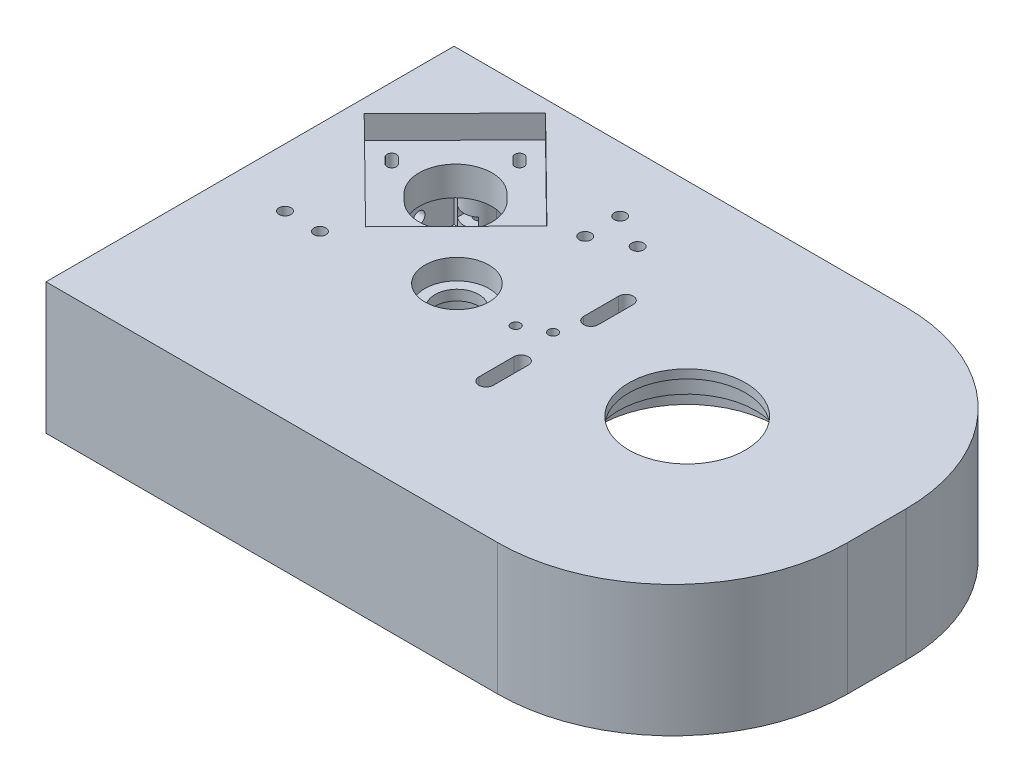
from build123d import *

# Parameters (mm, degrees)
SKETCH1_W               = 215
SKETCH1_H               = 140
BOSS_EXTRUDE1_DEPTH     = 10
FILLET1_R               = 60
SKETCH2_R               = 20
SKETCH2_R_2             = 7.5
CUT_EXTRUDE1_DEPTH      = 129.671092325
CUT_EXTRUDE2_DEPTH      = 129.671092325
CUT_EXTRUDE3_DEPTH      = 129.671092325
SKETCH5_R               = 11
CUT_EXTRUDE4_DEPTH      = 7
SKETCH6_R               = 14
SKETCH6_R_2             = 11
BOSS_EXTRUDE2_DEPTH     = 8.5
SKETCH7_R               = 23.5
CUT_EXTRUDE5_DEPTH      = 7
SKETCH8_R               = 38.5
SKETCH8_R_2             = 30.5
BOSS_EXTRUDE3_DEPTH     = 8
BOSS_EXTRUDE4_DEPTH     = 35
BOSS_EXTRUDE5_DEPTH     = 8
CUT_EXTRUDE6_DEPTH      = 8
SKETCH12_R              = 11
SKETCH12_R_2            = 7.5
BOSS_EXTRUDE6_DEPTH     = 0.5
BOSS_EXTRUDE7_REACH     = 137.946
SKETCH14_R              = 2.05
CUT_EXTRUDE7_DEPTH      = 3.6
BOSS_EXTRUDE8_REACH     = 137.946
SKETCH16_R              = 2.05
CUT_EXTRUDE8_START      = -3.6
CUT_EXTRUDE8_OUTLINE_R  = 2.05
CUT_EXTRUDE8_DEPTH      = 3.6
LPATTERN1_COUNT         = 3
LPATTERN1_PITCH         = 55
MIRROR2_COPY_1_REACH    = 137.946
MIRROR2_COPY_1_SKETCH_R = 2.05
MIRROR2_COPY_2_REACH    = 137.946
MIRROR2_COPY_2_SKETCH_R = 2.05
MIRROR2_START           = -3.6
MIRROR2_COPY_3_SKETCH_R = 2.05
MIRROR2_COPY_3_DEPTH    = 3.6
MIRROR2_COPY_4_SKETCH_R = 2.05
MIRROR2_COPY_4_DEPTH    = 3.6
BOSS_EXTRUDE9_REACH     = 137.946
SKETCH18_R              = 2.05
CUT_EXTRUDE9_DEPTH      = 3.6
BOSS_EXTRUDE10_DEPTH    = 8
CUT_EXTRUDE10_DEPTH     = 133.97086147
SKETCH22_R              = 1.6
CUT_EXTRUDE11_DEPTH     = 133.97086147
SKETCH23_R              = 2.05
CUT_EXTRUDE12_DEPTH     = 133.97086147
CUT_EXTRUDE13_REACH     = 230.801
SKETCH24_R              = 2.05


# Read off the part's stored shape, not the designer's step: Cut-Extrude8
with BuildPart() as part:
    # Sketch1 → Boss-Extrude1 (new body)
    with BuildSketch(Plane(origin=(0, 0, 0), x_dir=(1, 0, 0), z_dir=(0, 1, 0))):
        Rectangle(SKETCH1_W, SKETCH1_H)
    extrude(amount=BOSS_EXTRUDE1_DEPTH)

    # Fillet1
    fillet1_edges = [part.edges().sort_by_distance(p)[0] for p in [
        (107.5, 5, 70),
        (107.5, 5, -70),
    ]]
    fillet(fillet1_edges, radius=FILLET1_R)

    # Sketch2 → Cut-Extrude1 (cut, through all)
    with BuildSketch(Plane(origin=(0, 10, 0), x_dir=(1, 0, 0), z_dir=(0, 1, 0))):
        with Locations(Location((42.5, 0, 0), (0, 0, 270))):
            Circle(SKETCH2_R)
        with Locations(Location((-36.5, 0, 0), (0, 0, 270))):
            Circle(SKETCH2_R_2)
    extrude(amount=-CUT_EXTRUDE1_DEPTH, mode=Mode.SUBTRACT)

    # Sketch3 → Cut-Extrude2 (cut, through all)
    with BuildSketch(Plane(origin=(0, 10, 0), x_dir=(1, 0, 0), z_dir=(0, 1, 0))):
        with BuildLine():
            Line((-62.6171596, 43.302932631), (-60.480848158, 41.196710083))
            ThreePointArc((-60.480848158, 41.196710083), (-60.355477768, 23.519485123), (-78.032702727, 23.394114734))
            Line((-78.032702727, 23.394114734), (-80.169014169, 25.500337282))
            ThreePointArc((-80.169014169, 25.500337282), (-80.294384559, 43.177562241), (-62.6171596, 43.302932631))
        make_face()
    extrude(amount=-CUT_EXTRUDE2_DEPTH, mode=Mode.SUBTRACT)

    # Sketch4 → Cut-Extrude3 (cut, through all)
    with BuildSketch(Plane(origin=(0, 10, 0), x_dir=(1, 0, 0), z_dir=(0, 1, 0))):
        with BuildLine():
            Line((-48.467836076, 31.164041558), (-50.589156419, 33.285361902))
            ThreePointArc((-50.589156419, 33.285361902), (-50.589156419, 35.548103602), (-48.326414719, 35.548103602))
            Line((-48.326414719, 35.548103602), (-46.205094376, 33.426783258))
            ThreePointArc((-46.205094376, 33.426783258), (-46.205094376, 31.164041558), (-48.467836076, 31.164041558))
        make_face()
        with BuildLine():
            Line((-70.388146292, 53.084351775), (-72.509466636, 55.205672119))
            ThreePointArc((-72.509466636, 55.205672119), (-72.509466636, 57.468413818), (-70.246724936, 57.468413818))
            Line((-70.246724936, 57.468413818), (-68.125404593, 55.347093475))
            ThreePointArc((-68.125404593, 55.347093475), (-68.125404593, 53.084351775), (-70.388146292, 53.084351775))
        make_face()
        with BuildLine():
            Line((-70.388146292, 9.243731341), (-72.509466636, 11.365051685))
            ThreePointArc((-72.509466636, 11.365051685), (-72.509466636, 13.627793385), (-70.246724936, 13.627793385))
            Line((-70.246724936, 13.627793385), (-68.125404593, 11.506473041))
            ThreePointArc((-68.125404593, 11.506473041), (-68.125404593, 9.243731341), (-70.388146292, 9.243731341))
        make_face()
        with BuildLine():
            Line((-92.308456509, 31.164041558), (-94.429776853, 33.285361902))
            ThreePointArc((-94.429776853, 33.285361902), (-94.429776853, 35.548103602), (-92.167035153, 35.548103602))
            Line((-92.167035153, 35.548103602), (-90.045714809, 33.426783258))
            ThreePointArc((-90.045714809, 33.426783258), (-90.045714809, 31.164041558), (-92.308456509, 31.164041558))
        make_face()
    extrude(amount=-CUT_EXTRUDE3_DEPTH, mode=Mode.SUBTRACT)

    # Sketch5 → Cut-Extrude4 (cut)
    with BuildSketch(Plane(origin=(0, 10, 0), x_dir=(1, 0, 0), z_dir=(0, 1, 0))):
        with Locations(Location((-36.5, 0, 0), (0, 0, 270))):
            Circle(SKETCH5_R)
    extrude(amount=-CUT_EXTRUDE4_DEPTH, mode=Mode.SUBTRACT)

    # Sketch6 → Boss-Extrude2 (add)
    with BuildSketch(Plane.XZ):
        with Locations(Location((-36.5, 0, 0), (0, 0, 270))):
            Circle(SKETCH6_R)
        with Locations(Location((-36.5, 0, 0), (0, 0, 90))):
            Circle(SKETCH6_R_2, mode=Mode.SUBTRACT)
    extrude(amount=BOSS_EXTRUDE2_DEPTH)

    # Sketch7 → Cut-Extrude5 (cut)
    with BuildSketch(Plane.XZ):
        with Locations(Location((42.5, 0, 0), (0, 0, 270))):
            Circle(SKETCH7_R)
    extrude(amount=-CUT_EXTRUDE5_DEPTH, mode=Mode.SUBTRACT)

    # Sketch8 → Boss-Extrude3 (add)
    with BuildSketch(Plane.XZ):
        with Locations(Location((42.5, 0, 0), (0, 0, 270))):
            Circle(SKETCH8_R)
        with Locations(Location((42.5, 0, 0), (0, 0, 270))):
            Circle(SKETCH8_R_2, mode=Mode.SUBTRACT)
    extrude(amount=BOSS_EXTRUDE3_DEPTH)

    # Sketch9 → Boss-Extrude4 (add)
    with BuildSketch(Plane.XZ):
        with BuildLine():
            Line((-107.5, -70), (47.5, -70))
            ThreePointArc((47.5, -70), (89.926406871, -52.426406871), (107.5, -10))
            Line((107.5, -10), (107.5, 10))
            ThreePointArc((107.5, 10), (89.926406871, 52.426406871), (47.5, 70))
            Line((47.5, 70), (-107.5, 70))
            Line((-107.5, 70), (-107.5, -70))
        make_face()
        with BuildLine():
            Line((47.5, 62), (-99.5, 62))
            Line((-99.5, 62), (-99.5, -62))
            Line((-99.5, -62), (47.5, -62))
            ThreePointArc((47.5, -62), (84.269552622, -46.769552622), (99.5, -10))
            Line((99.5, -10), (99.5, 10))
            ThreePointArc((99.5, 10), (84.269552622, 46.769552622), (47.5, 62))
        make_face(mode=Mode.SUBTRACT)
    extrude(amount=BOSS_EXTRUDE4_DEPTH)

    # Sketch10 → Boss-Extrude5 (add)
    with BuildSketch(Plane.XZ):
        with BuildLine():
            Line((-36.5, -14), (-36.5, -62))
            Line((-36.5, -62), (-99.5, -62))
            Line((-99.5, -62), (-99.5, 0))
            Line((-99.5, 0), (-50.5, 0))
            ThreePointArc((-50.5, 0), (-46.399494937, -9.899494937), (-36.5, -14))
        make_face()
        with BuildLine():
            Line((-80.169014169, -25.500337282), (-78.032702727, -23.394114734))
            ThreePointArc((-78.032702727, -23.394114734), (-60.355477768, -23.519485123), (-60.480848158, -41.196710083))
            Line((-60.480848158, -41.196710083), (-62.6171596, -43.302932631))
            ThreePointArc((-62.6171596, -43.302932631), (-80.294384559, -43.177562241), (-80.169014169, -25.500337282))
        make_face(mode=Mode.SUBTRACT)
        with BuildLine():
            Line((-94.429776853, -33.285361902), (-92.308456509, -31.164041558))
            ThreePointArc((-92.308456509, -31.164041558), (-90.045714809, -31.164041558), (-90.045714809, -33.426783258))
            Line((-90.045714809, -33.426783258), (-92.167035153, -35.548103602))
            ThreePointArc((-92.167035153, -35.548103602), (-94.429776853, -35.548103602), (-94.429776853, -33.285361902))
        make_face(mode=Mode.SUBTRACT)
        with BuildLine():
            Line((-68.125404593, -55.347093475), (-70.246724936, -57.468413818))
            ThreePointArc((-70.246724936, -57.468413818), (-72.509466636, -57.468413818), (-72.509466636, -55.205672119))
            Line((-72.509466636, -55.205672119), (-70.388146292, -53.084351775))
            ThreePointArc((-70.388146292, -53.084351775), (-68.125404593, -53.084351775), (-68.125404593, -55.347093475))
        make_face(mode=Mode.SUBTRACT)
        with BuildLine():
            Line((-46.205094376, -33.426783258), (-48.326414719, -35.548103602))
            ThreePointArc((-48.326414719, -35.548103602), (-50.589156419, -35.548103602), (-50.589156419, -33.285361902))
            Line((-50.589156419, -33.285361902), (-48.467836076, -31.164041558))
            ThreePointArc((-48.467836076, -31.164041558), (-46.205094376, -31.164041558), (-46.205094376, -33.426783258))
        make_face(mode=Mode.SUBTRACT)
        with BuildLine():
            Line((-68.125404593, -11.506473041), (-70.246724936, -13.627793385))
            ThreePointArc((-70.246724936, -13.627793385), (-72.509466636, -13.627793385), (-72.509466636, -11.365051685))
            Line((-72.509466636, -11.365051685), (-70.388146292, -9.243731341))
            ThreePointArc((-70.388146292, -9.243731341), (-68.125404593, -9.243731341), (-68.125404593, -11.506473041))
        make_face(mode=Mode.SUBTRACT)
    extrude(amount=BOSS_EXTRUDE5_DEPTH)

    # Sketch11 → Cut-Extrude6 (cut)
    with BuildSketch(Plane(origin=(0, 10, 0), x_dir=(1, 0, 0), z_dir=(0, 1, 0))):
        Polygon((-102.86105472, 34.532020162), (-71.969790677, 65.864587976), (-38.144859514, 32.516064294), (-69.036123556, 1.18349648), align=None)
    extrude(amount=-CUT_EXTRUDE6_DEPTH, mode=Mode.SUBTRACT)

    # Sketch12 → Boss-Extrude6 (add)
    with BuildSketch(Plane.XZ):
        with Locations(Location((-36.5, 0, 0), (0, 0, 90))):
            Circle(SKETCH12_R)
        with Locations(Location((-36.5, 0, 0), (0, 0, 90))):
            Circle(SKETCH12_R_2, mode=Mode.SUBTRACT)
    extrude(amount=BOSS_EXTRUDE6_DEPTH)

    # Sketch14 → Boss-Extrude7 (add, up to next)
    with BuildSketch(Plane.XZ.offset(35), mode=Mode.PRIVATE) as boss_extrude7_sk1:
        with BuildLine():
            Line((61.391194045, 60.110225783), (60.333474536, 57.556665))
            ThreePointArc((60.333474536, 57.556665), (63.337112892, 50.305240545), (70.588537347, 53.308878901))
            Line((70.588537347, 53.308878901), (71.711379603, 56.019659904))
            ThreePointArc((71.711379603, 56.019659904), (66.660759692, 58.341134534), (61.391194045, 60.110225783))
        make_face()
        with Locations(Location((65.461005942, 55.432771951, 0), (0, 0, 270))):
            Circle(SKETCH14_R, mode=Mode.SUBTRACT)
    boss_extrude7_tool1 = extrude(boss_extrude7_sk1.sketch, amount=-BOSS_EXTRUDE7_REACH, mode=Mode.PRIVATE) - part.part
    # Sketch14 → Boss-Extrude7 (add, up to next)
    with BuildSketch(Plane.XZ.offset(35), mode=Mode.PRIVATE) as boss_extrude7_sk2:
        with BuildLine():
            ThreePointArc((98.972980454, 17.3845977), (97.876725035, 22.891298414), (96.193134966, 28.247701421))
            Line((96.193134966, 28.247701421), (93.037240304, 26.94048705))
            ThreePointArc((93.037240304, 26.94048705), (90.033601948, 19.689062595), (97.285026403, 16.685424239))
            Line((97.285026403, 16.685424239), (98.972980454, 17.3845977))
        make_face()
        with Locations(Location((95.161133353, 21.812955645, 0), (0, 0, 270))):
            Circle(SKETCH14_R, mode=Mode.SUBTRACT)
    boss_extrude7_tool2 = extrude(boss_extrude7_sk2.sketch, amount=-BOSS_EXTRUDE7_REACH, mode=Mode.PRIVATE) - part.part
    boss_extrude7_1 = boss_extrude7_tool1.solids().sort_by_distance((61.006604, -35, 58.773687))[0]
    add(boss_extrude7_1)
    boss_extrude7_2 = boss_extrude7_tool2.solids().sort_by_distance((97.729394, -35, 22.853597))[0]
    add(boss_extrude7_2)
    boss_extrude7 = boss_extrude7_1 + boss_extrude7_2  # Boss-Extrude7 as one shape, for the pattern or mirror that repeats it

    # Sketch15 → Cut-Extrude7 (cut)
    with BuildSketch(Plane(origin=(0, -25, 0), x_dir=(-1, 0, 0), z_dir=(0, -1, 0))):
        with BuildLine():
            Line((-92.636291132, -16.870519833), (-98.459041258, -19.282381905))
            Line((-98.459041258, -19.282381905), (-99.00162845, -23.4037408))
            Line((-99.00162845, -23.4037408), (-95.703720545, -25.93431454))
            Line((-95.703720545, -25.93431454), (-89.880970419, -23.522452467))
            ThreePointArc((-89.880970419, -23.522452467), (-90.033601948, -19.689062595), (-92.636291132, -16.870519833))
        make_face()
        with BuildLine():
            Line((-67.170502764, -50.152609016), (-69.582364837, -55.975359143))
            Line((-69.582364837, -55.975359143), (-67.051791097, -59.273267048))
            Line((-67.051791097, -59.273267048), (-62.930432203, -58.730679856))
            Line((-62.930432203, -58.730679856), (-60.51857013, -52.907929729))
            ThreePointArc((-60.51857013, -52.907929729), (-63.337112892, -50.305240545), (-67.170502764, -50.152609016))
        make_face()
    cut_extrude7 = extrude(amount=-CUT_EXTRUDE7_DEPTH, mode=Mode.SUBTRACT)

    # Mirror1: Boss-Extrude7, Cut-Extrude7 across plane
    add(boss_extrude7.mirror(Plane.XY))
    add(cut_extrude7.mirror(Plane.XY), mode=Mode.SUBTRACT)

    # Sketch16 → Boss-Extrude8 (add, up to next)
    with BuildSketch(Plane.XZ.offset(35), mode=Mode.PRIVATE) as boss_extrude8_sk1:
        with BuildLine():
            Line((16.95, 59), (16.95, 62))
            Line((16.95, 62), (28.05, 62))
            Line((28.05, 62), (28.05, 59))
            ThreePointArc((28.05, 59), (22.5, 53.45), (16.95, 59))
        make_face()
        with Locations(Location((22.5, 59, 0), (0, 0, 270))):
            Circle(SKETCH16_R, mode=Mode.SUBTRACT)
    boss_extrude8_tool1 = extrude(boss_extrude8_sk1.sketch, amount=-BOSS_EXTRUDE8_REACH, mode=Mode.PRIVATE) - part.part
    boss_extrude8 = boss_extrude8_tool1.solids().sort_by_distance((17.090112, -35, 60.5))[0]
    add(boss_extrude8)

    # Cut-Extrude8 outline → Cut-Extrude8 (cut)
    with BuildSketch(Plane(origin=(0, -25, 0), x_dir=(-1, 0, 0), z_dir=(0, -1, 0)).offset(CUT_EXTRUDE8_START)):
        with BuildLine():
            Line((-22.5, -63.156921938), (-18.9, -61.078460969))
            Line((-18.9, -61.078460969), (-18.9, -54.775961648))
            ThreePointArc((-18.9, -54.775961648), (-22.5, -53.45), (-26.1, -54.775961648))
            Line((-26.1, -54.775961648), (-26.1, -61.078460969))
            Line((-26.1, -61.078460969), (-22.5, -63.156921938))
        make_face()
        with Locations((-22.5, -59)):
            Circle(CUT_EXTRUDE8_OUTLINE_R, mode=Mode.SUBTRACT)
    cut_extrude8 = extrude(amount=CUT_EXTRUDE8_DEPTH, mode=Mode.SUBTRACT)

    # LPattern1: Boss-Extrude8, Cut-Extrude8 ×3
    with Locations(*[(-i * LPATTERN1_PITCH, 0, 0) for i in range(1, LPATTERN1_COUNT)]):
        add(boss_extrude8)
        add(cut_extrude8, mode=Mode.SUBTRACT)

    # Mirror2: Boss-Extrude8, Cut-Extrude8 across plane
    add(boss_extrude8.mirror(Plane.XY))
    add(cut_extrude8.mirror(Plane.XY), mode=Mode.SUBTRACT)

    # Mirror2 copy 1 sketch → Mirror2 copy 1 (add, up to next)
    with BuildSketch(Plane(origin=(-55, -35, 0), x_dir=(1, 0, 0), z_dir=(0, -1, 0)), mode=Mode.PRIVATE) as mirror2_copy_1_sk1:
        with BuildLine():
            Line((16.95, -59), (16.95, -62))
            Line((16.95, -62), (28.05, -62))
            Line((28.05, -62), (28.05, -59))
            ThreePointArc((28.05, -59), (22.5, -53.45), (16.95, -59))
        make_face()
        with Locations((22.5, -59)):
            Circle(MIRROR2_COPY_1_SKETCH_R, mode=Mode.SUBTRACT)
    mirror2_copy_1_tool1 = extrude(mirror2_copy_1_sk1.sketch, amount=-MIRROR2_COPY_1_REACH, mode=Mode.PRIVATE) - part.part
    add(mirror2_copy_1_tool1.solids().sort_by_distance((-37.909888, -35, -60.5))[0])

    # Mirror2 copy 2 sketch → Mirror2 copy 2 (add, up to next)
    with BuildSketch(Plane(origin=(-110, -35, 0), x_dir=(1, 0, 0), z_dir=(0, -1, 0)), mode=Mode.PRIVATE) as mirror2_copy_2_sk1:
        with BuildLine():
            Line((16.95, -59), (16.95, -62))
            Line((16.95, -62), (28.05, -62))
            Line((28.05, -62), (28.05, -59))
            ThreePointArc((28.05, -59), (22.5, -53.45), (16.95, -59))
        make_face()
        with Locations((22.5, -59)):
            Circle(MIRROR2_COPY_2_SKETCH_R, mode=Mode.SUBTRACT)
    mirror2_copy_2_tool1 = extrude(mirror2_copy_2_sk1.sketch, amount=-MIRROR2_COPY_2_REACH, mode=Mode.PRIVATE) - part.part
    add(mirror2_copy_2_tool1.solids().sort_by_distance((-92.909888, -35, -60.5))[0])

    # Mirror2 copy 3 sketch → Mirror2 copy 3 (cut)
    with BuildSketch(Plane(origin=(-55, -25, 0), x_dir=(-1, 0, 0), z_dir=(0, -1, 0)).offset(MIRROR2_START)):
        with BuildLine():
            Line((-22.5, 63.156921938), (-18.9, 61.078460969))
            Line((-18.9, 61.078460969), (-18.9, 54.775961648))
            ThreePointArc((-18.9, 54.775961648), (-22.5, 53.45), (-26.1, 54.775961648))
            Line((-26.1, 54.775961648), (-26.1, 61.078460969))
            Line((-26.1, 61.078460969), (-22.5, 63.156921938))
        make_face()
        with Locations((-22.5, 59)):
            Circle(MIRROR2_COPY_3_SKETCH_R, mode=Mode.SUBTRACT)
    extrude(amount=MIRROR2_COPY_3_DEPTH, mode=Mode.SUBTRACT)

    # Mirror2 copy 4 sketch → Mirror2 copy 4 (cut)
    with BuildSketch(Plane(origin=(-110, -25, 0), x_dir=(-1, 0, 0), z_dir=(0, -1, 0)).offset(MIRROR2_START)):
        with BuildLine():
            Line((-22.5, 63.156921938), (-18.9, 61.078460969))
            Line((-18.9, 61.078460969), (-18.9, 54.775961648))
            ThreePointArc((-18.9, 54.775961648), (-22.5, 53.45), (-26.1, 54.775961648))
            Line((-26.1, 54.775961648), (-26.1, 61.078460969))
            Line((-26.1, 61.078460969), (-22.5, 63.156921938))
        make_face()
        with Locations((-22.5, 59)):
            Circle(MIRROR2_COPY_4_SKETCH_R, mode=Mode.SUBTRACT)
    extrude(amount=MIRROR2_COPY_4_DEPTH, mode=Mode.SUBTRACT)

    # Sketch18 → Boss-Extrude9 (add, up to next)
    with BuildSketch(Plane.XZ.offset(35), mode=Mode.PRIVATE) as boss_extrude9_sk1:
        with BuildLine():
            Line((-96.5, 28.55), (-99.5, 28.55))
            Line((-99.5, 28.55), (-99.5, 17.45))
            Line((-99.5, 17.45), (-96.5, 17.45))
            ThreePointArc((-96.5, 17.45), (-90.95, 23), (-96.5, 28.55))
        make_face()
        with Locations(Location((-96.5, 23, 0), (0, 0, 270))):
            Circle(SKETCH18_R, mode=Mode.SUBTRACT)
    boss_extrude9_tool1 = extrude(boss_extrude9_sk1.sketch, amount=-BOSS_EXTRUDE9_REACH, mode=Mode.PRIVATE) - part.part
    boss_extrude9 = boss_extrude9_tool1.solids().sort_by_distance((-98, -35, 28.409888))[0]
    add(boss_extrude9)

    # Sketch19 → Cut-Extrude9 (cut)
    with BuildSketch(Plane(origin=(0, -25, 0), x_dir=(-1, 0, 0), z_dir=(0, -1, 0))):
        with BuildLine():
            Line((98.578460969, -19.4), (92.275961648, -19.4))
            ThreePointArc((92.275961648, -19.4), (90.95, -23), (92.275961648, -26.6))
            Line((92.275961648, -26.6), (98.578460969, -26.6))
            Line((98.578460969, -26.6), (100.656921938, -23))
            Line((100.656921938, -23), (98.578460969, -19.4))
        make_face()
    cut_extrude9 = extrude(amount=-CUT_EXTRUDE9_DEPTH, mode=Mode.SUBTRACT)

    # Mirror3: Boss-Extrude9, Cut-Extrude9 across plane
    add(boss_extrude9.mirror(Plane.XY))
    add(cut_extrude9.mirror(Plane.XY), mode=Mode.SUBTRACT)

    # Sketch20 → Boss-Extrude10 (add)
    with BuildSketch(Plane.XZ):
        with BuildLine():
            Line((-25.156854249, 62), (12.595291742, 24.247854008))
            ThreePointArc((12.595291742, 24.247854008), (15.276388924, 27.223611076), (18.252145992, 29.904708258))
            Line((18.252145992, 29.904708258), (-13.843145751, 62))
            Line((-13.843145751, 62), (-25.156854249, 62))
        make_face()
        with BuildLine():
            Line((38.5, 62), (38.5, 38.291643997))
            ThreePointArc((38.5, 38.291643997), (42.5, 38.5), (46.5, 38.291643997))
            Line((46.5, 38.291643997), (46.5, 62))
            Line((46.5, 62), (38.5, 62))
        make_face()
        with BuildLine():
            Line((83.939658706, 47.096512955), (66.747854008, 29.904708258))
            ThreePointArc((66.747854008, 29.904708258), (69.723611076, 27.223611076), (72.404708258, 24.247854008))
            Line((72.404708258, 24.247854008), (89.209849092, 41.052994843))
            ThreePointArc((89.209849092, 41.052994843), (86.691420235, 44.176491627), (83.939658706, 47.096512955))
        make_face()
        with BuildLine():
            ThreePointArc((81, 0), (80.947875714, -2.002711426), (80.791643997, -4))
            Line((80.791643997, -4), (99.5, -4))
            Line((99.5, -4), (99.5, 4))
            Line((99.5, 4), (80.791643997, 4))
            ThreePointArc((80.791643997, 4), (80.947875714, 2.002711426), (81, 0))
        make_face()
        with BuildLine():
            ThreePointArc((72.404708258, -24.247854008), (69.723611076, -27.223611076), (66.747854008, -29.904708258))
            Line((66.747854008, -29.904708258), (83.939658706, -47.096512955))
            ThreePointArc((83.939658706, -47.096512955), (86.691420235, -44.176491627), (89.209849092, -41.052994843))
            Line((89.209849092, -41.052994843), (72.404708258, -24.247854008))
        make_face()
        with BuildLine():
            ThreePointArc((46.5, -38.291643997), (42.5, -38.5), (38.5, -38.291643997))
            Line((38.5, -38.291643997), (38.5, -62))
            Line((38.5, -62), (46.5, -62))
            Line((46.5, -62), (46.5, -38.291643997))
        make_face()
        with BuildLine():
            Line((12.595291742, -24.247854008), (-25.156854249, -62))
            Line((-25.156854249, -62), (-13.843145751, -62))
            Line((-13.843145751, -62), (18.252145992, -29.904708258))
            ThreePointArc((18.252145992, -29.904708258), (15.276388924, -27.223611076), (12.595291742, -24.247854008))
        make_face()
    extrude(amount=BOSS_EXTRUDE10_DEPTH)

    # Sketch21 → Cut-Extrude10 (cut, through all)
    with BuildSketch(Plane.XZ):
        with BuildLine():
            Line((-5, 12), (-5, 24))
            ThreePointArc((-5, 24), (-2.5, 26.5), (0, 24))
            Line((0, 24), (0, 12))
            ThreePointArc((0, 12), (-2.5, 9.5), (-5, 12))
        make_face()
        with BuildLine():
            Line((0, -12), (0, -24))
            ThreePointArc((0, -24), (-2.5, -26.5), (-5, -24))
            Line((-5, -24), (-5, -12))
            ThreePointArc((-5, -12), (-2.5, -9.5), (0, -12))
        make_face()
    extrude(amount=-CUT_EXTRUDE10_DEPTH, mode=Mode.SUBTRACT)

    # Sketch22 → Cut-Extrude11 (cut, through all)
    with BuildSketch(Plane.XZ):
        with Locations(Location((-5.5, -2, 0), (0, 0, 270))):
            Circle(SKETCH22_R)
        with Locations(Location((-13.888002132, 2.459979846, 0), (0, 0, 270))):
            Circle(SKETCH22_R)
    extrude(amount=-CUT_EXTRUDE11_DEPTH, mode=Mode.SUBTRACT)

    # Sketch23 → Cut-Extrude12 (cut, through all)
    with BuildSketch(Plane.XZ):
        with Locations(Location((-87.5, 8, 0), (0, 0, 270))):
            Circle(SKETCH23_R)
        with Locations(Location((-75.5, 8, 0), (0, 0, 270))):
            Circle(SKETCH23_R)
        with Locations(Location((-28.5, -36, 0), (0, 0, 270))):
            Circle(SKETCH23_R)
        with Locations(Location((-28.5, -48, 0), (0, 0, 270))):
            Circle(SKETCH23_R)
        with Locations(Location((-16.5, -42, 0), (0, 0, 270))):
            Circle(SKETCH23_R)
    extrude(amount=-CUT_EXTRUDE12_DEPTH, mode=Mode.SUBTRACT)

    # Sketch24 → Cut-Extrude13 (cut, up to next)
    with BuildSketch(Plane.ZY.offset(107.5), mode=Mode.PRIVATE) as cut_extrude13_sk1:
        with Locations((0, -27)):
            Circle(SKETCH24_R)
    cut_extrude13_tool1 = extrude(cut_extrude13_sk1.sketch, amount=-CUT_EXTRUDE13_REACH, mode=Mode.PRIVATE) & part.part
    # Sketch24 → Cut-Extrude13 (cut, up to next)
    with BuildSketch(Plane.ZY.offset(107.5), mode=Mode.PRIVATE) as cut_extrude13_sk2:
        with Locations((0, -13)):
            Circle(SKETCH24_R)
    cut_extrude13_tool2 = extrude(cut_extrude13_sk2.sketch, amount=-CUT_EXTRUDE13_REACH, mode=Mode.PRIVATE) & part.part
    # Sketch24 → Cut-Extrude13 (cut, up to next)
    with BuildSketch(Plane.ZY.offset(107.5), mode=Mode.PRIVATE) as cut_extrude13_sk3:
        with Locations((-50, -13)):
            Circle(SKETCH24_R)
    cut_extrude13_tool3 = extrude(cut_extrude13_sk3.sketch, amount=-CUT_EXTRUDE13_REACH, mode=Mode.PRIVATE) & part.part
    # Sketch24 → Cut-Extrude13 (cut, up to next)
    with BuildSketch(Plane.ZY.offset(107.5), mode=Mode.PRIVATE) as cut_extrude13_sk4:
        with Locations((-50, -27)):
            Circle(SKETCH24_R)
    cut_extrude13_tool4 = extrude(cut_extrude13_sk4.sketch, amount=-CUT_EXTRUDE13_REACH, mode=Mode.PRIVATE) & part.part
    # Sketch24 → Cut-Extrude13 (cut, up to next)
    with BuildSketch(Plane.ZY.offset(107.5), mode=Mode.PRIVATE) as cut_extrude13_sk5:
        with Locations((50, -13)):
            Circle(SKETCH24_R)
    cut_extrude13_tool5 = extrude(cut_extrude13_sk5.sketch, amount=-CUT_EXTRUDE13_REACH, mode=Mode.PRIVATE) & part.part
    # Sketch24 → Cut-Extrude13 (cut, up to next)
    with BuildSketch(Plane.ZY.offset(107.5), mode=Mode.PRIVATE) as cut_extrude13_sk6:
        with Locations((50, -27)):
            Circle(SKETCH24_R)
    cut_extrude13_tool6 = extrude(cut_extrude13_sk6.sketch, amount=-CUT_EXTRUDE13_REACH, mode=Mode.PRIVATE) & part.part
    add(cut_extrude13_tool1.solids().sort_by_distance((-107.5, -27, 0))[0], mode=Mode.SUBTRACT)
    add(cut_extrude13_tool2.solids().sort_by_distance((-107.5, -13, 0))[0], mode=Mode.SUBTRACT)
    add(cut_extrude13_tool3.solids().sort_by_distance((-107.5, -13, -50))[0], mode=Mode.SUBTRACT)
    add(cut_extrude13_tool4.solids().sort_by_distance((-107.5, -27, -50))[0], mode=Mode.SUBTRACT)
    add(cut_extrude13_tool5.solids().sort_by_distance((-107.5, -13, 50))[0], mode=Mode.SUBTRACT)
    add(cut_extrude13_tool6.solids().sort_by_distance((-107.5, -27, 50))[0], mode=Mode.SUBTRACT)


solid = part.part
